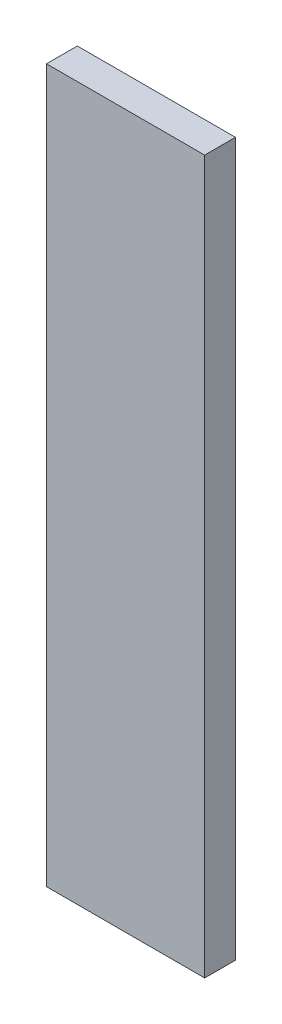
from build123d import *

# Parameters (mm, degrees)
SKETCH1_W            = 6.8
SKETCH1_H            = 6.8
SKETCH1_W_2          = 5.2
SKETCH1_H_2          = 5.2
EXTRUDE_THIN1_DEPTH  = 4
LPATTERN1_COUNT      = 5
LPATTERN1_PITCH      = 6
LPATTERN1_COUNT_DIR2 = 23
LPATTERN1_PITCH_DIR2 = 6
SKETCH2_W            = 30.8
SKETCH2_H            = 138.8
BOSS_EXTRUDE1_DEPTH  = 2


with BuildPart() as part:
    # Sketch1 → Extrude-Thin1 (new body)
    with BuildSketch(Plane.XY):
        Rectangle(SKETCH1_W, SKETCH1_H)
        Rectangle(SKETCH1_W_2, SKETCH1_H_2, mode=Mode.SUBTRACT)
    extrude_thin1 = extrude(amount=-EXTRUDE_THIN1_DEPTH)

    # LPattern1: Extrude-Thin1 5 × 23
    with Locations(*[(-i * LPATTERN1_PITCH, j * LPATTERN1_PITCH_DIR2, 0) for i in range(LPATTERN1_COUNT) for j in range(LPATTERN1_COUNT_DIR2) if (i, j) != (0, 0)]):
        add(extrude_thin1)

    # Sketch2 → Boss-Extrude1 (add)
    with BuildSketch(Plane.XY):
        with Locations((-12, 66)):
            Rectangle(SKETCH2_W, SKETCH2_H)
    extrude(amount=BOSS_EXTRUDE1_DEPTH)


solid = part.part
